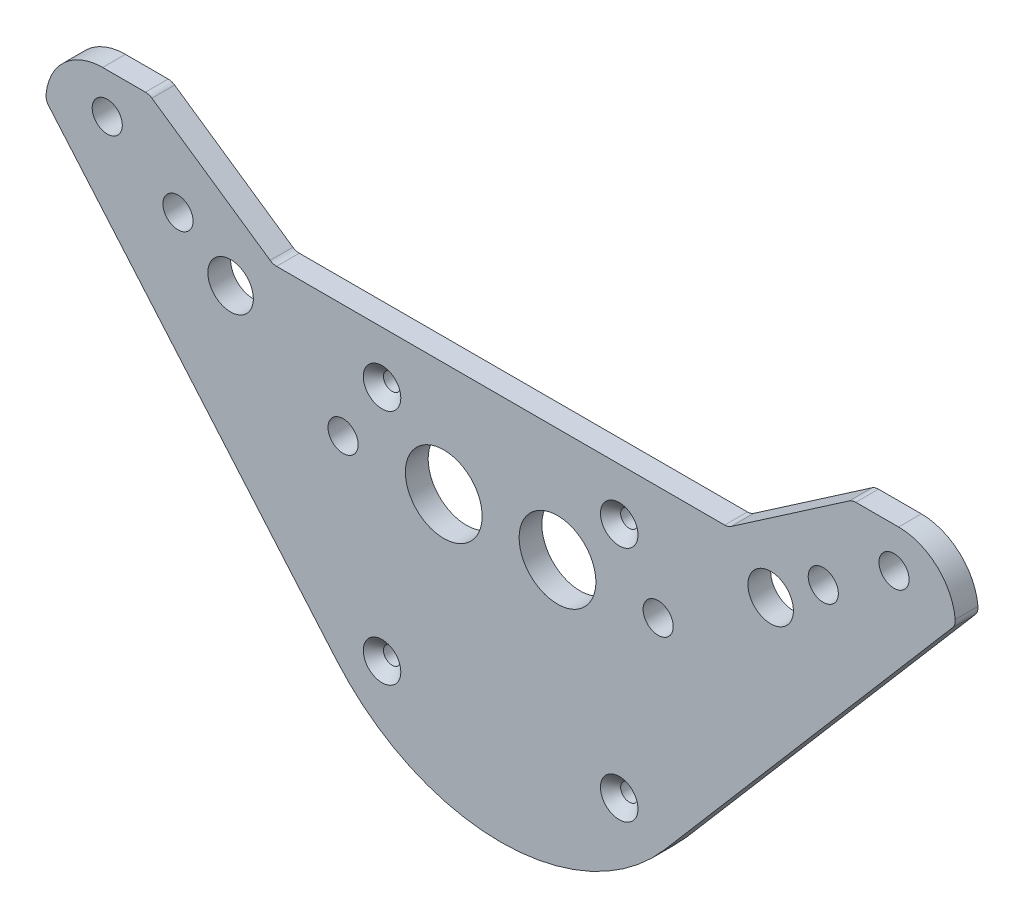
from build123d import *

# Parameters (mm, degrees)
SKETCH_1_W                   = 160
SKETCH_1_H                   = 120
EXTRUDE_1_DEPTH              = 4
SKETCH_2_R                   = 4
SKETCH_2_R_2                 = 2.65
SKETCH_2_R_3                 = 6.75
CUT_EXTRUDE_1_DEPTH          = 24
CUT_EXTRUDE_2_DEPTH          = 54
SKETCH_5_R                   = 1.525
CUT_EXTRUDE_3_DEPTH          = 54
CUT_EXTRUDE_4_DEPTH          = 84
FILLET_1_R                   = 10
HOLE_WIZARD_M3_1_D           = 3.05
HOLE_WIZARD_M3_1_DEPTH       = 7.5
HOLE_WIZARD_M3_1_CSINK_D     = 6.6
HOLE_WIZARD_M3_1_CSINK_ANGLE = 90
HOLE_WIZARD_M3_1_TIP         = 0.916312444
FILLET_2_R                   = 2


with BuildPart() as part:
    # 草图1 → 凸台-拉伸1 (new body)
    with BuildSketch(Plane.XY):
        Rectangle(SKETCH_1_W, SKETCH_1_H)
    extrude(amount=EXTRUDE_1_DEPTH)

    # 草图2 → 切除-拉伸1 (cut)
    with BuildSketch(Plane(origin=(0, 0, 0), x_dir=(-1, 0, 0), z_dir=(0, 0, -1))):
        with Locations((-47.5, 38)):
            Circle(SKETCH_2_R)
        with Locations((-56.749921469, 44.53912734)):
            Circle(SKETCH_2_R_2)
        with Locations((-69.194904497, 52.913039057)):
            Circle(SKETCH_2_R_2)
        with Locations((-27.711627738, 25)):
            Circle(SKETCH_2_R_2)
        with Locations((-10, 25)):
            Circle(SKETCH_2_R_3)
    cut_extrude_1 = extrude(amount=-CUT_EXTRUDE_1_DEPTH, mode=Mode.SUBTRACT)

    # 镜向1: 切除-拉伸1 across plane
    add(cut_extrude_1.mirror(Plane(origin=(0, 0, 0), x_dir=(0, 0, 1), z_dir=(1, 0, 0))), mode=Mode.SUBTRACT)

    # 草图3 → 切除-拉伸2 (cut)
    with BuildSketch(Plane(origin=(0, 0, 0), x_dir=(-1, 0, 0), z_dir=(0, 0, -1))):
        Polygon((-61.851610318, 60), (-40.030198451, 45), (40.030198451, 45), (61.851610318, 60), align=None)
    extrude(amount=-CUT_EXTRUDE_2_DEPTH, mode=Mode.SUBTRACT)

    # 草图5 → 切除-拉伸3 (cut)
    with BuildSketch(Plane(origin=(0, 0, 0), x_dir=(-1, 0, 0), z_dir=(0, 0, -1))):
        with Locations((-20.859650045, 35.859650045)):
            Circle(SKETCH_5_R)
        with Locations((-20.859650045, -5.859650045)):
            Circle(SKETCH_5_R)
        with Locations((20.859650045, -5.859650045)):
            Circle(SKETCH_5_R)
        with Locations((20.859650045, 35.859650045)):
            Circle(SKETCH_5_R)
    extrude(amount=-CUT_EXTRUDE_3_DEPTH, mode=Mode.SUBTRACT)

    # 草图6 → 切除-拉伸4 (cut)
    with BuildSketch(Plane(origin=(0, 0, 0), x_dir=(-1, 0, 0), z_dir=(0, 0, -1))):
        with BuildLine():
            Line((-80, 50), (-28.863438287, -9.71643037))
            ThreePointArc((-28.863438287, -9.71643037), (0, -23), (28.863438287, -9.71643037))
            Line((28.863438287, -9.71643037), (80, 50))
            Line((80, 50), (80, -60))
            Line((80, -60), (-80, -60))
            Line((-80, -60), (-80, 50))
        make_face()
    extrude(amount=-CUT_EXTRUDE_4_DEPTH, mode=Mode.SUBTRACT)

    # 圆角1
    fillet_1_edges = [part.edges().sort_by_distance(p)[0] for p in [
        (-80, 60, 2),
        (80, 60, 2),
    ]]
    fillet(fillet_1_edges, radius=FILLET_1_R - 0.0001)  # a hair under: the kernel refuses the full size

    # M3 十字槽半沉头木螺钉的锥形沉头孔1
    with Locations(Plane.XY.offset(4)):
        with Locations((-20.859650045, 35.859650045), (20.859650045, 35.859650045), (20.859650045, -5.859650045), (-20.859650045, -5.859650045)):
            CounterSinkHole(HOLE_WIZARD_M3_1_D / 2, HOLE_WIZARD_M3_1_CSINK_D / 2, depth=HOLE_WIZARD_M3_1_DEPTH, counter_sink_angle=HOLE_WIZARD_M3_1_CSINK_ANGLE)
            with Locations((0, 0, -(HOLE_WIZARD_M3_1_DEPTH + HOLE_WIZARD_M3_1_TIP / 2))):  # 118° drill point
                Cone(0, HOLE_WIZARD_M3_1_D / 2, HOLE_WIZARD_M3_1_TIP, mode=Mode.SUBTRACT)

    # 圆角2
    fillet_2_edges = [part.edges().sort_by_distance(p)[0] for p in [
        (80, 50, 2),
        (-80, 50, 2),
        (61.851610318, 60, 2),
        (-61.851610318, 60, 2),
        (-40.030198451, 45, 2),
        (40.030198451, 45, 2),
    ]]
    fillet(fillet_2_edges, radius=FILLET_2_R)


solid = part.part
